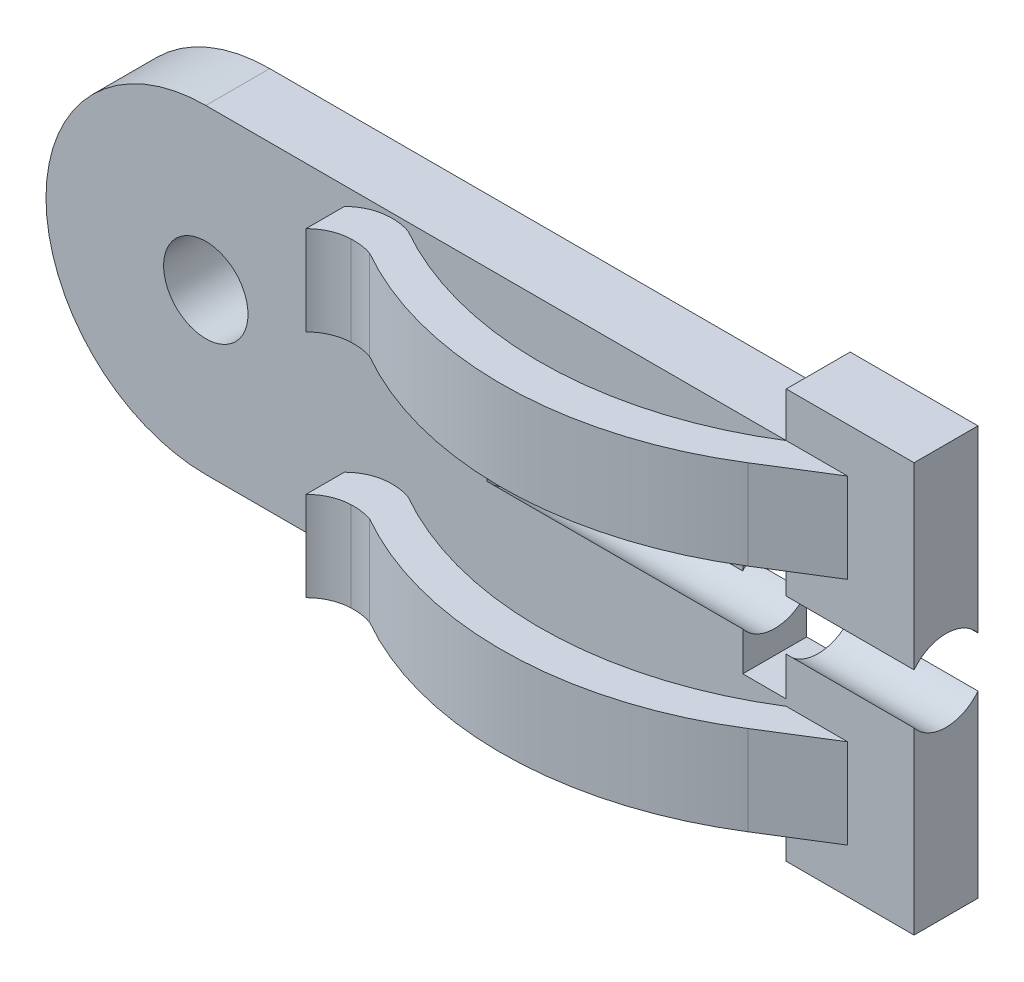
from build123d import *

# Parameters (mm, degrees)
SKETCH1_R           = 1.65
BOSS_EXTRUDE1_DEPTH = 2.5
SKETCH2_W           = 5
SKETCH2_H           = 16
BOSS_EXTRUDE2_DEPTH = 2.5
SKETCH3_W           = 1.7
SKETCH3_H           = 5
CUT_EXTRUDE1_DEPTH  = 29.940283343
SKETCH6_R           = 1.59
CUT_EXTRUDE3_DEPTH  = 16.7
BOSS_EXTRUDE3_DEPTH = 3.5
BOSS_EXTRUDE5_DEPTH = 3.5


with BuildPart() as part:
    # Sketch1 → Boss-Extrude1 (new body)
    with BuildSketch(Plane.XY):
        with BuildLine():
            ThreePointArc((0, 6.25), (-6.25, 0), (0, -6.25))
            Line((0, -6.25), (22.7, -6.25))
            Line((22.7, -6.25), (22.7, 6.25))
            Line((22.7, 6.25), (0, 6.25))
        make_face()
        Circle(SKETCH1_R, mode=Mode.SUBTRACT)
    extrude(amount=BOSS_EXTRUDE1_DEPTH)

    # Sketch2 → Boss-Extrude2 (add)
    with BuildSketch(Plane.XY.offset(2.5)):
        with Locations((25.2, 0)):
            Rectangle(SKETCH2_W, SKETCH2_H)
    extrude(amount=-BOSS_EXTRUDE2_DEPTH)

    # Sketch3 → Cut-Extrude1 (cut, through all)
    with BuildSketch(Plane.XY.offset(2.5)):
        with Locations((21.85, 0)):
            Rectangle(SKETCH3_W, SKETCH3_H)
    extrude(amount=-CUT_EXTRUDE1_DEPTH, mode=Mode.SUBTRACT)

    # Sketch6 → Cut-Extrude3 (cut)
    with BuildSketch(Plane(origin=(27.7, 0, 0), x_dir=(0, 0, -1), z_dir=(1, 0, 0))):
        with Locations((-1.25, 0)):
            Circle(SKETCH6_R)
    extrude(amount=-CUT_EXTRUDE3_DEPTH, mode=Mode.SUBTRACT)


with BuildPart() as body_2:
    # Sketch7 → Boss-Extrude3 (new body)
    with BuildSketch(Plane.XZ.offset(6.25)):
        with BuildLine():
            Line((6.129900512, 3.210673711), (6.129900512, 4.710673711))
            ThreePointArc((6.129900512, 4.710673711), (6.694341527, 4.327552018), (7.360579964, 4.180915603))
            ThreePointArc((7.360579964, 4.180915603), (7.789326283, 4.199870579), (8.206709695, 4.299739418))
            ThreePointArc((8.206709695, 4.299739418), (15.494742209, 6.151071465), (22.7, 4))
            Line((22.7, 4), (22.7, 2.5))
            ThreePointArc((22.7, 2.5), (15.494742209, 4.651071465), (8.206709695, 2.799739418))
            ThreePointArc((8.206709695, 2.799739418), (7.789326283, 2.699870579), (7.360579964, 2.680915603))
            ThreePointArc((7.360579964, 2.680915603), (6.694341527, 2.827552018), (6.129900512, 3.210673711))
        make_face()
    extrude(amount=-BOSS_EXTRUDE3_DEPTH)


with BuildPart() as body_3:
    # Sketch9 → Boss-Extrude5 (new body)
    with BuildSketch(Plane.XZ.offset(6.25)):
        Polygon((22.7, 4), (25.104907101, 2.5), (22.7, 2.5), align=None)
    extrude(amount=-BOSS_EXTRUDE5_DEPTH)

    # Combine1: union body 2
    add(body_2.part)


with BuildPart() as body_3_2:
    # Mirror5: mirrored copy
    add(body_3.part.mirror(Plane(origin=(0, 0, 0), x_dir=(0, 0, 1), z_dir=(0, -1, 0))))


with BuildPart() as part_1:
    add(part.part)

    # Combine4: union body 3, body 3 2
    add(body_3.part)
    add(body_3_2.part)


solid = part_1.part
